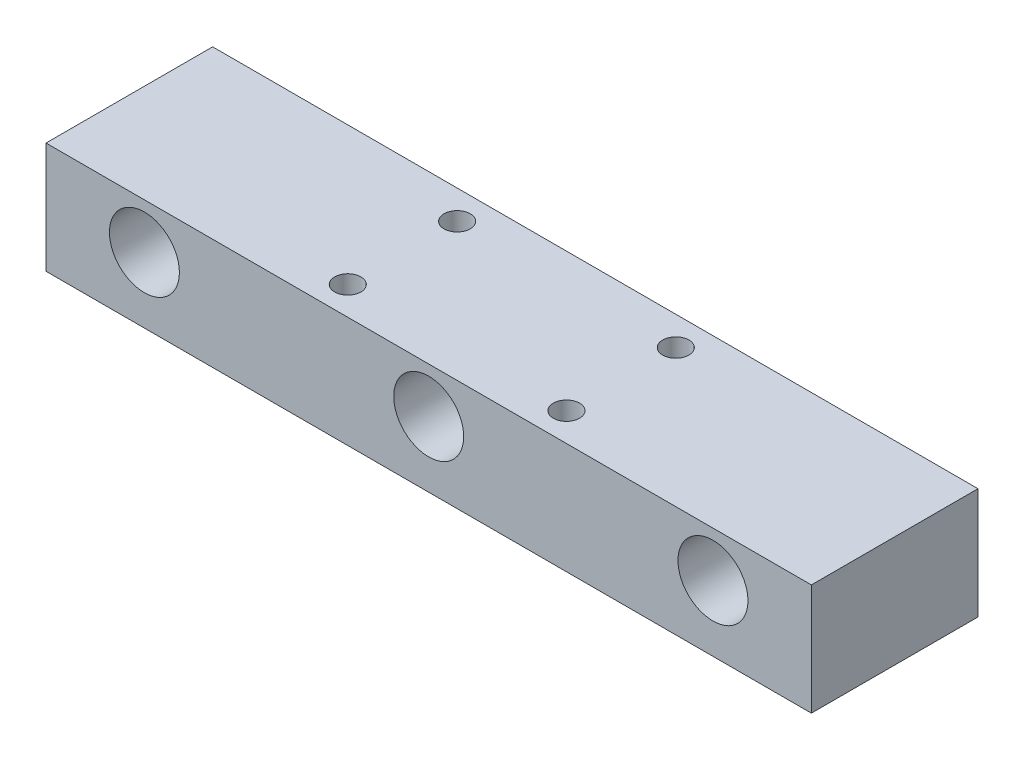
from build123d import *

# Parameters (mm, degrees)
SKETCH1_W           = 350
SKETCH1_H           = 76.2
BOSS_EXTRUDE1_DEPTH = 50.8
SKETCH3_R           = 6
CUT_EXTRUDE2_DEPTH  = 50.8
SKETCH5_R           = 16
CUT_EXTRUDE3_DEPTH  = 362.783194745


with BuildPart() as part:
    # Sketch1 → Boss-Extrude1 (new body)
    with BuildSketch(Plane(origin=(0, 0, 0), x_dir=(1, 0, 0), z_dir=(0, 1, 0))):
        with Locations((175, 38.1)):
            Rectangle(SKETCH1_W, SKETCH1_H)
    extrude(amount=BOSS_EXTRUDE1_DEPTH)

    # Sketch3 → Cut-Extrude2 (cut)
    with BuildSketch(Plane(origin=(0, 50.8, 0), x_dir=(1, 0, 0), z_dir=(0, 1, 0))):
        with Locations((125, 63)):
            Circle(SKETCH3_R)
        with Locations((125, 13)):
            Circle(SKETCH3_R)
        with Locations((225, 63)):
            Circle(SKETCH3_R)
        with Locations((225, 13)):
            Circle(SKETCH3_R)
    extrude(amount=-CUT_EXTRUDE2_DEPTH, mode=Mode.SUBTRACT)

    # Sketch5 → Cut-Extrude3 (cut, through all)
    with BuildSketch(Plane.XY):
        with Locations((175, 30)):
            Circle(SKETCH5_R)
        with Locations((305, 30)):
            Circle(SKETCH5_R)
        with Locations((45, 30)):
            Circle(SKETCH5_R)
    extrude(amount=-CUT_EXTRUDE3_DEPTH, mode=Mode.SUBTRACT)


solid = part.part
